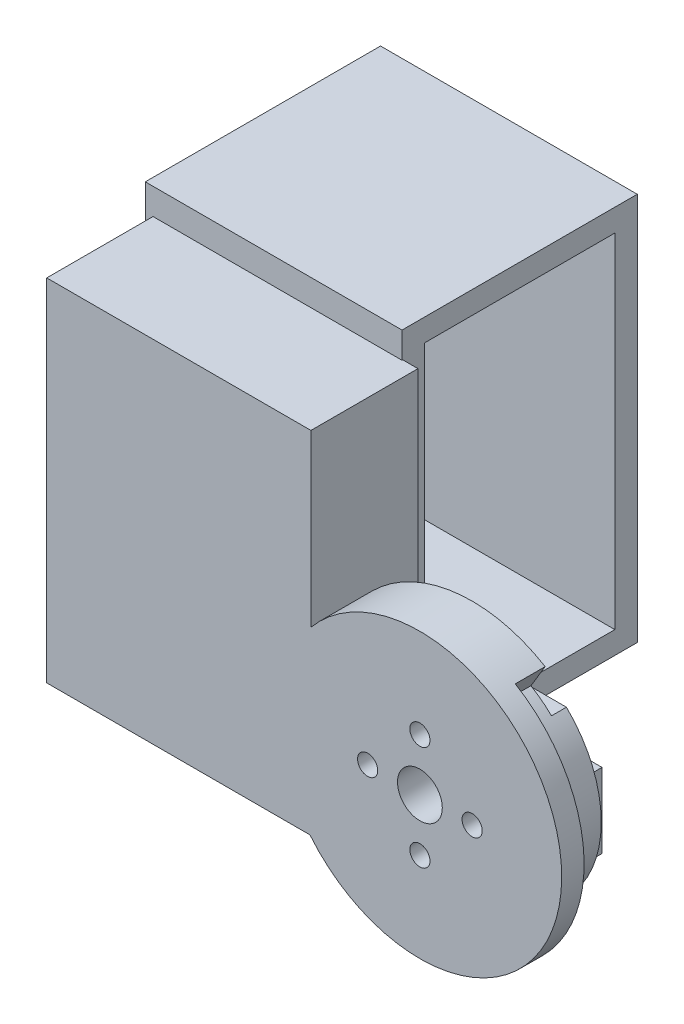
from build123d import *
from build123d.topology import SkipClean

# Parameters (mm, degrees)
S_CYL1_R      = 19
BOSS_1_DEPTH  = 7
BOSS_2_DEPTH  = 2.1
S_BOX3_W      = 28.2
S_BOX3_H      = 10
BOSS_3_DEPTH  = 1.5
S_BOX4_W      = 35.4
S_BOX4_H      = 47
BOSS_4_DEPTH  = 14.34
S_BOX5_W      = 34.4
S_BOX5_H      = 3
BOSS_5_DEPTH  = 31.52
S_BOX6_W      = 34.4
S_BOX6_H      = 3
BOSS_6_DEPTH  = 31.52
S_BOX7_W      = 34.4
S_BOX7_H      = 52.02
BOSS_7_DEPTH  = 3
S_BOX8_W      = 34.4
S_BOX8_H      = 52.02
BOSS_8_DEPTH  = 3
S_BOX9_W      = 2.4
S_BOX9_H      = 52.02
BOSS_9_DEPTH  = 31.52
S_HOLE10_R    = 11
HOLE_10_DEPTH = 2.6
S_HOLE11_R    = 1.1
HOLE_11_DEPTH = 2.6
S_HOLE12_R    = 1.1
HOLE_12_DEPTH = 2.6
S_HOLE13_R    = 1.1
HOLE_13_DEPTH = 2.6
CUT_14_DEPTH  = 6.1
S_HOLE15_R    = 3
HOLE_15_DEPTH = 10.6
S_HOLE16_R    = 1.35
HOLE_16_DEPTH = 10.6
S_HOLE17_R    = 1.35
HOLE_17_DEPTH = 10.6
S_HOLE18_R    = 1.35
HOLE_18_DEPTH = 10.6
S_HOLE19_R    = 1.35
HOLE_19_DEPTH = 10.6
S_HOLE20_R    = 2.3
HOLE_20_DEPTH = 4.5
S_HOLE21_R    = 2.3
HOLE_21_DEPTH = 4.5
S_HOLE22_R    = 2.3
HOLE_22_DEPTH = 4.5
S_HOLE23_R    = 2.3
HOLE_23_DEPTH = 4.5


with BuildPart() as part:
    # S_cyl1 → Boss_1 (new body)
    with BuildSketch(Plane.XY.offset(23)):
        Circle(S_CYL1_R)
    extrude(amount=BOSS_1_DEPTH)

    # S_prism2 → Boss_2 (add)
    with SkipClean():  # the faces are left unmerged after this step: merging them gives an invalid solid
        with BuildSketch(Plane.XY.offset(21)):
            with BuildLine():
                Line((-15.491933385, 11), (15.491933385, 11))
                ThreePointArc((15.491933385, 11), (19, 0), (15.491933385, -11))
                Line((15.491933385, -11), (-15.491933385, -11))
                ThreePointArc((-15.491933385, -11), (-19, 0), (-15.491933385, 11))
            make_face()
        extrude(amount=BOSS_2_DEPTH)

    # S_box3 → Boss_3 (add)
    with SkipClean():  # the faces are left unmerged after this step: merging them gives an invalid solid
        with BuildSketch(Plane.XY.offset(19.6)):
            with Locations((-0.1, 0)):
                Rectangle(S_BOX3_W, S_BOX3_H)
        extrude(amount=BOSS_3_DEPTH)

    # S_box4 → Boss_4 (add)
    with BuildSketch(Plane.XY.offset(15.66)):
        with Locations((-32.3, 11.5)):
            Rectangle(S_BOX4_W, S_BOX4_H)
    extrude(amount=BOSS_4_DEPTH)

    # S_box6 → Boss_6 (add)
    with BuildSketch(Plane.XY.offset(-15.76)):
        with Locations((-33.835, -12.01)):
            Rectangle(S_BOX6_W, S_BOX6_H)
    extrude(amount=BOSS_6_DEPTH)



with BuildPart() as body_2:
    # S_box5 → Boss_5 (new body)
    with BuildSketch(Plane.XY.offset(-15.76)):
        with Locations((-33.835, 37.01)):
            Rectangle(S_BOX5_W, S_BOX5_H)
    extrude(amount=BOSS_5_DEPTH)


with BuildPart() as part_1:
    add(part.part)

    add(body_2.part)  # Boss_7 merges body 2
    # S_box7 → Boss_7 (add)
    with BuildSketch(Plane.XY.offset(-15.76)):
        with Locations((-33.835, 12.5)):
            Rectangle(S_BOX7_W, S_BOX7_H)
    extrude(amount=BOSS_7_DEPTH)

    # S_box8 → Boss_8 (add)
    with BuildSketch(Plane.XY.offset(12.76)):
        with Locations((-33.835, 12.5)):
            Rectangle(S_BOX8_W, S_BOX8_H)
    extrude(amount=BOSS_8_DEPTH)

    # S_box9 → Boss_9 (add)
    with BuildSketch(Plane.XY.offset(-15.76)):
        with Locations((-49.835, 12.5)):
            Rectangle(S_BOX9_W, S_BOX9_H)
    extrude(amount=BOSS_9_DEPTH)

    # S_hole10 → Hole_10 (cut)
    with BuildSketch(Plane(origin=(-51.135, 0, 0), x_dir=(0, 0, -1), z_dir=(1, 0, 0))):
        Circle(S_HOLE10_R)
    extrude(amount=HOLE_10_DEPTH, mode=Mode.SUBTRACT)

    # S_hole11 → Hole_11 (cut)
    with BuildSketch(Plane(origin=(-51.135, 0, 0), x_dir=(0, 0, -1), z_dir=(1, 0, 0))):
        with Locations((-10.25, 8.3)):
            Circle(S_HOLE11_R)
    extrude(amount=HOLE_11_DEPTH, mode=Mode.SUBTRACT)

    # S_hole12 → Hole_12 (cut)
    with BuildSketch(Plane(origin=(-51.135, 0, 0), x_dir=(0, 0, -1), z_dir=(1, 0, 0))):
        with Locations((10.25, 32.75)):
            Circle(S_HOLE12_R)
    extrude(amount=HOLE_12_DEPTH, mode=Mode.SUBTRACT)

    # S_hole13 → Hole_13 (cut)
    with BuildSketch(Plane(origin=(-51.135, 0, 0), x_dir=(0, 0, -1), z_dir=(1, 0, 0))):
        with Locations((-10.25, 32.75)):
            Circle(S_HOLE13_R)
    extrude(amount=HOLE_13_DEPTH, mode=Mode.SUBTRACT)

    # S_pcut14 → Cut_14 (cut)
    with BuildSketch(Plane.XY.offset(20.9)):
        with BuildLine():
            Line((-9.201642631, -17.30577282), (-7.182914911, -13.509098171))
            ThreePointArc((-7.182914911, -13.509098171), (13.316442148, -7.53408047), (7.880082546, 13.114659701))
            Line((7.880082546, 13.114659701), (10.094746268, 16.800479094))
            ThreePointArc((10.094746268, 16.800479094), (17.05897164, -9.651501778), (-9.201642631, -17.30577282))
        make_face()
    extrude(amount=CUT_14_DEPTH, mode=Mode.SUBTRACT)

    # S_hole15 → Hole_15 (cut)
    with BuildSketch(Plane.XY.offset(19.5)):
        Circle(S_HOLE15_R)
    extrude(amount=HOLE_15_DEPTH, mode=Mode.SUBTRACT)

    # S_hole16 → Hole_16 (cut)
    with BuildSketch(Plane.XY.offset(19.5)):
        with Locations((7, 0)):
            Circle(S_HOLE16_R)
    extrude(amount=HOLE_16_DEPTH, mode=Mode.SUBTRACT)

    # S_hole17 → Hole_17 (cut)
    with BuildSketch(Plane.XY.offset(19.5)):
        with Locations((0, -7)):
            Circle(S_HOLE17_R)
    extrude(amount=HOLE_17_DEPTH, mode=Mode.SUBTRACT)

    # S_hole18 → Hole_18 (cut)
    with BuildSketch(Plane.XY.offset(19.5)):
        with Locations((-7, 0)):
            Circle(S_HOLE18_R)
    extrude(amount=HOLE_18_DEPTH, mode=Mode.SUBTRACT)

    # S_hole19 → Hole_19 (cut)
    with BuildSketch(Plane.XY.offset(19.5)):
        with Locations((0, 7)):
            Circle(S_HOLE19_R)
    extrude(amount=HOLE_19_DEPTH, mode=Mode.SUBTRACT)

    # S_hole20 → Hole_20 (cut)
    with BuildSketch(Plane.XY.offset(19.5)):
        with Locations((7, 0)):
            Circle(S_HOLE20_R)
    extrude(amount=HOLE_20_DEPTH, mode=Mode.SUBTRACT)

    # S_hole21 → Hole_21 (cut)
    with BuildSketch(Plane.XY.offset(19.5)):
        with Locations((0, -7)):
            Circle(S_HOLE21_R)
    extrude(amount=HOLE_21_DEPTH, mode=Mode.SUBTRACT)

    # S_hole22 → Hole_22 (cut)
    with BuildSketch(Plane.XY.offset(19.5)):
        with Locations((-7, 0)):
            Circle(S_HOLE22_R)
    extrude(amount=HOLE_22_DEPTH, mode=Mode.SUBTRACT)

    # S_hole23 → Hole_23 (cut)
    with BuildSketch(Plane.XY.offset(19.5)):
        with Locations((0, 7)):
            Circle(S_HOLE23_R)
    extrude(amount=HOLE_23_DEPTH, mode=Mode.SUBTRACT)


solid = part_1.part
